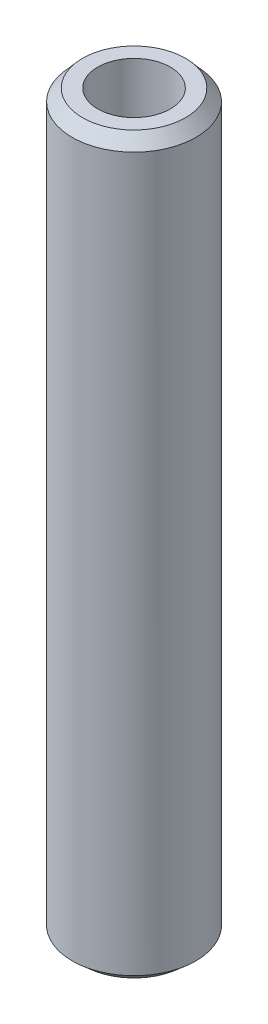
from build123d import *
from OCP.BRepFilletAPI import BRepFilletAPI_MakeChamfer

# Parameters (mm, degrees)
SKETCH1_R           = 27.5
BOSS_EXTRUDE1_DEPTH = 326.854234604
SKETCH2_R           = 16.128644555
CUT_EXTRUDE1_DEPTH  = 330.159825432
CHAMFER1_SIZE       = 5.271247179
CHAMFER1_SIZE2      = 4.614495006


with BuildPart() as part:
    # Sketch1 → Boss-Extrude1 (new body)
    with BuildSketch(Plane(origin=(0, 0, 0), x_dir=(1, 0, 0), z_dir=(0, 1, 0))):
        Circle(SKETCH1_R)
    extrude(amount=BOSS_EXTRUDE1_DEPTH)

    # Sketch2 → Cut-Extrude1 (cut, through all)
    with BuildSketch(Plane(origin=(0, 0, 0), x_dir=(1, 0, 0), z_dir=(0, 1, 0))):
        Circle(SKETCH2_R)
    extrude(amount=CUT_EXTRUDE1_DEPTH, mode=Mode.SUBTRACT)

    # Chamfer1: one chamfer whose edges measure the first distance from different faces: ONE call of the kernel's chamfer builder (chamfer() names one face for all edges)
    chamfer1_edges_1 = [part.edges().sort_by_distance(p)[0] for p in [
        (-27.5, 326.854234604, 0),
    ]]
    chamfer1_side_1 = [part.faces().sort_by_distance(p)[0] for p in [
        (-27.5, 163.427117302, 0),
    ]]
    chamfer1_edges_2 = [part.edges().sort_by_distance(p)[0] for p in [
        (-27.5, 0, 0),
    ]]
    chamfer1_side_2 = [part.faces().sort_by_distance(p)[0] for p in [
        (-26.722182541, 0, 0),
    ]]
    chamfer1 = BRepFilletAPI_MakeChamfer(part.part.solid().wrapped)
    for e in chamfer1_edges_1:
        chamfer1.Add(CHAMFER1_SIZE, CHAMFER1_SIZE2, e.wrapped, chamfer1_side_1[0].wrapped)  # the first distance lies on this face
    for e in chamfer1_edges_2:
        chamfer1.Add(CHAMFER1_SIZE, CHAMFER1_SIZE2, e.wrapped, chamfer1_side_2[0].wrapped)  # the first distance lies on this face
    add(Compound.cast(chamfer1.Shape()), mode=Mode.REPLACE)


solid = part.part
